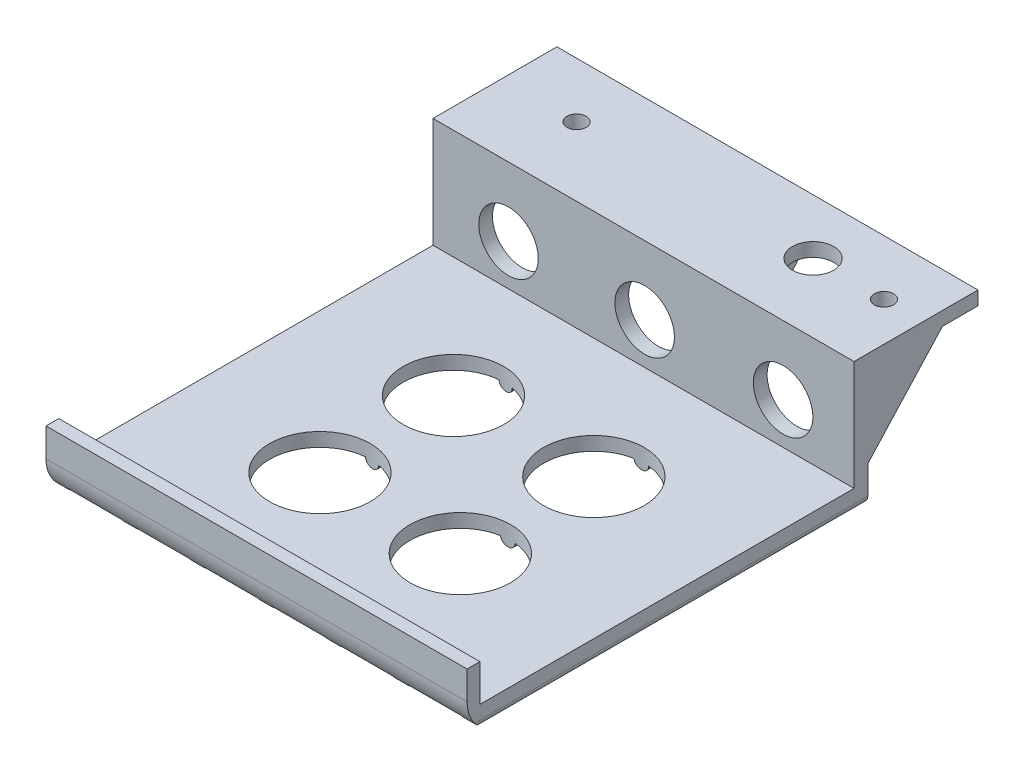
from build123d import *

# Parameters (mm, degrees)
BOSS_EXTRU_1_DEPTH           = 92
NERVURE2_REACH               = 267.583
ESQUISSE3_WALL_W             = 557.337159988
ESQUISSE3_WALL_H             = 1
R_P_TITION_LIN_AIRE1_COUNT   = 4
R_P_TITION_LIN_AIRE1_PITCH   = 30
ESQUISSE4_R                  = 6.5
ENL_V_MAT_EXTRU_1_DEPTH      = 3
ESQUISSE6_R                  = 1.5
BOSS_EXTRU_2_DEPTH           = 87.544216856
R_P_TITION_LIN_AIRE2_COUNT   = 7
R_P_TITION_LIN_AIRE2_PITCH   = 14.833333333
ENL_V_MAT_EXTRU_2_DEPTH      = 3
ENL_V_MAT_EXTRU_2_DEPTH_BACK = 3
ESQUISSE5_R                  = 11
ENL_V_START                  = -92
ENL_V_MAT_EXTRU_3_DEPTH      = 92
CONG_1_R                     = 8
ESQUISSE9_R                  = 4.5
ENL_V_MAT_EXTRU_5_DEPTH      = 3
ESQUISSE8_R                  = 2.1
ENL_V_MAT_EXTRU_4_DEPTH      = 3


with BuildPart() as part:
    # Esquisse1 → Boss.-Extru.1 (new body)
    with BuildSketch(Plane(origin=(0, 0, 0), x_dir=(0, 0, -1), z_dir=(1, 0, 0))):
        Polygon((-109.489716306, -87.800176517), (-136.569905432, -87.800176517), (-136.569905432, -111.800176517), (-218.114122288, -111.800176517), (-218.314122288, -111.800176517), (-218.314122288, -103.710391053), (-221.114122288, -103.710391053), (-221.114122288, -114.800176517), (-133.569905432, -114.800176517), (-133.569905432, -90.800176517), (-109.489716306, -90.800176517), align=None)
    extrude(amount=-BOSS_EXTRU_1_DEPTH)

    # Esquisse3 wall → Nervure2 (add, up to next)
    with BuildSketch(Plane(origin=(0, -99.717919792, 125.413574296), x_dir=(0, -0.737906584765, 0.674902861278), z_dir=(0, -0.674902861278, -0.737906584765)), mode=Mode.PRIVATE) as nervure2_sk1:
        with Locations((0, 0.5)):
            Rectangle(ESQUISSE3_WALL_W, ESQUISSE3_WALL_H)
    nervure2_tool1 = extrude(nervure2_sk1.sketch, amount=-NERVURE2_REACH, mode=Mode.PRIVATE) - part.part
    nervure2 = nervure2_tool1.solids().sort_by_distance((0, -99.717919792, 125.413574296))[0]
    add(nervure2)

    # Répétition linéaire1: Nervure2 ×4
    with Locations(*[(-i * R_P_TITION_LIN_AIRE1_PITCH, 0, 0) for i in range(1, R_P_TITION_LIN_AIRE1_COUNT)]):
        add(nervure2)

    # Esquisse4 → Enlèv. mat.-Extru.1 (cut)
    with BuildSketch(Plane(origin=(0, 0, 133.569905432), x_dir=(-1, 0, 0), z_dir=(0, 0, -1))):
        with Locations((15.5, -102.800176517)):
            Circle(ESQUISSE4_R)
        with Locations((45.75, -102.800176517)):
            Circle(ESQUISSE4_R)
        with Locations((75.5, -102.800176517)):
            Circle(ESQUISSE4_R)
    extrude(amount=-ENL_V_MAT_EXTRU_1_DEPTH, mode=Mode.SUBTRACT)

    # Esquisse6 → Boss.-Extru.2 (add)
    with BuildSketch(Plane(origin=(0, 0, 133.569905432), x_dir=(-1, 0, 0), z_dir=(0, 0, -1))):
        with Locations((1.5, -114.800176517)):
            Circle(ESQUISSE6_R)
    boss_extru_2 = extrude(amount=-BOSS_EXTRU_2_DEPTH)

    # Répétition linéaire2: Boss.-Extru.2 ×7
    with Locations(*[(-i * R_P_TITION_LIN_AIRE2_PITCH, 0, 0) for i in range(1, R_P_TITION_LIN_AIRE2_COUNT)]):
        add(boss_extru_2)

    # Esquisse5 → Enlèv. mat.-Extru.2 (cut, two sides: drawn at the far end of the back side and taken through both)
    with BuildSketch(Plane(origin=(0, -114.800176517, 0), x_dir=(-1, 0, 0), z_dir=(0, -1, 0)).offset(-ENL_V_MAT_EXTRU_2_DEPTH_BACK)):
        with Locations(Location((30.666666667, -162.751311051, 0), (0, 0, 264.78409143))):
            Circle(ESQUISSE5_R)
        with Locations(Location((61.333333333, -162.751311051, 0), (0, 0, 275.21590857))):
            Circle(ESQUISSE5_R)
        with Locations(Location((61.333333333, -191.93271667, 0), (0, 0, 275.21590857))):
            Circle(ESQUISSE5_R)
        with Locations(Location((30.666666667, -191.93271667, 0), (0, 0, 264.78409143))):
            Circle(ESQUISSE5_R)
    extrude(amount=ENL_V_MAT_EXTRU_2_DEPTH + ENL_V_MAT_EXTRU_2_DEPTH_BACK, mode=Mode.SUBTRACT)

    # Esquisse7 → Enlèv. mat.-Extru.3 (cut)
    with BuildSketch(Plane(origin=(0, 0, 0), x_dir=(0, 0, -1), z_dir=(1, 0, 0)).offset(ENL_V_START)):
        Polygon((-221.114122288, -113.242817204), (-218.056762976, -116.300176517), (-221.114122288, -116.300176517), align=None)
    extrude(amount=ENL_V_MAT_EXTRU_3_DEPTH, mode=Mode.SUBTRACT)

    # Congé1
    # the kernel refuses this fillet: 8 mm, written as the material it takes off along each edge
    with BuildSketch(Plane(origin=(-100.284271247, -113.242817204, 221.114122288), x_dir=(0, -0.7071067811865497, -0.7071067811865454), z_dir=(1, 0, 0))) as cong_1_piece_1:
        with BuildLine():
            CenterArc((CONG_1_R * 0.414213562373, CONG_1_R), CONG_1_R, 225, 45)
            Line((-CONG_1_R * 0.292893218813, CONG_1_R * 0.292893218813), (0, 0))
            Line((0, 0), (CONG_1_R * 0.414213562373, 0))
        make_face()
    extrude(amount=108.568542495, mode=Mode.SUBTRACT)

    # Esquisse9 → Enlèv. mat.-Extru.5 (cut)
    with BuildSketch(Plane.XZ.offset(90.800176517)):
        with Locations(Location((-24, 121.529810869, 0), (0, 0, 270))):
            Circle(ESQUISSE9_R)
    extrude(amount=-ENL_V_MAT_EXTRU_5_DEPTH, mode=Mode.SUBTRACT)

    # Esquisse8 → Enlèv. mat.-Extru.4 (cut)
    with BuildSketch(Plane.XZ.offset(90.800176517)):
        with Locations(Location((-8.506517848, 121.529810869, 0), (0, 0, 270))):
            Circle(ESQUISSE8_R)
        with Locations(Location((-75.666666667, 121.529810869, 0), (0, 0, 270))):
            Circle(ESQUISSE8_R)
    extrude(amount=-ENL_V_MAT_EXTRU_4_DEPTH, mode=Mode.SUBTRACT)


solid = part.part
